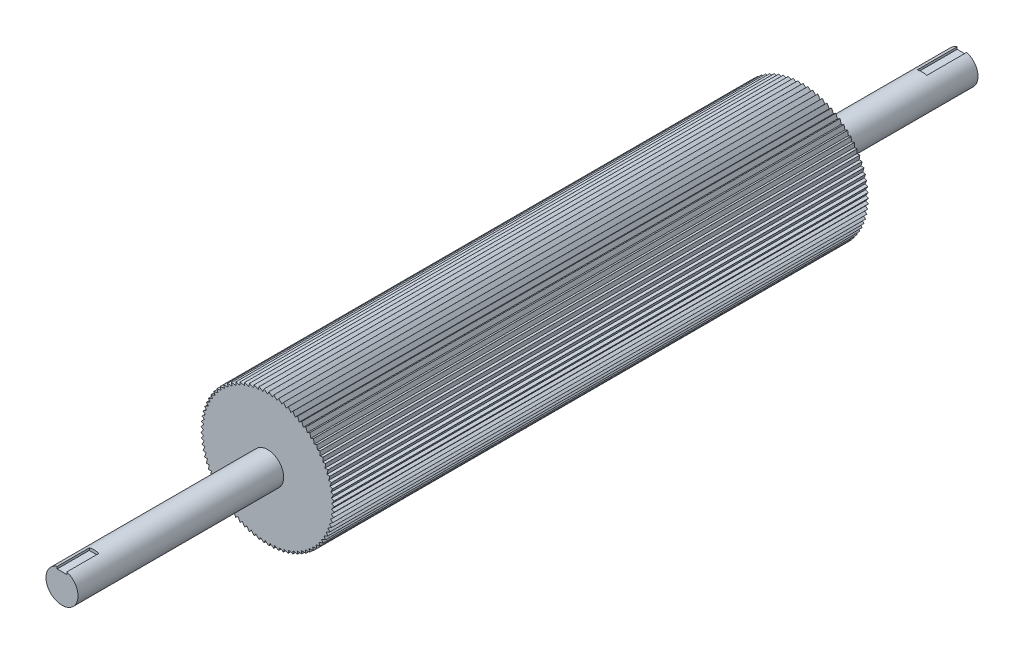
from build123d import *

# Parameters (mm, degrees)
SKETCH2_R           = 125
BOSS_EXTRUDE1_DEPTH = 500
SKETCH3_R           = 30
BOSS_EXTRUDE2_DEPTH = 385
BOSS_EXTRUDE3_START = 300
SKETCH4_R           = 30
BOSS_EXTRUDE3_DEPTH = 300
SKETCH12_W          = 18
SKETCH12_H          = 11
CUT_EXTRUDE5_DEPTH  = 60
CUT_EXTRUDE6_DEPTH  = 1312.96417634
CIRPATTERN1_COUNT   = 85
SKETCH16_W          = 18
SKETCH16_H          = 11
CUT_EXTRUDE7_DEPTH  = 75


with BuildPart() as part:
    # Sketch2 → Boss-Extrude1 (new, symmetric)
    with BuildSketch(Plane.XY):
        Circle(SKETCH2_R)
    extrude(amount=BOSS_EXTRUDE1_DEPTH, both=True)

    # Sketch3 → Boss-Extrude2 (add)
    with BuildSketch(Plane.XY.offset(500)):
        Circle(SKETCH3_R)
    extrude(amount=BOSS_EXTRUDE2_DEPTH)

    # Sketch4 → Boss-Extrude3 (add)
    with BuildSketch(Plane(origin=(0, 0, -500), x_dir=(-1, 0, 0), z_dir=(0, 0, -1)).offset(BOSS_EXTRUDE3_START)):
        Circle(SKETCH4_R)
    extrude(amount=-BOSS_EXTRUDE3_DEPTH)

    # Sketch12 → Cut-Extrude5 (cut)
    with BuildSketch(Plane.XY.offset(885)):
        with Locations((0, 30)):
            Rectangle(SKETCH12_W, SKETCH12_H)
    extrude(amount=-CUT_EXTRUDE5_DEPTH, mode=Mode.SUBTRACT)

    # Sketch15 → Cut-Extrude6 (cut, through all)
    with BuildSketch(Plane.XY.offset(500)):
        with BuildLine():
            Line((0, 120), (2.321485149, 124.978440968))
            ThreePointArc((2.321485149, 124.978440968), (-2.276223403, 124.97927351), (-6.870852473, 124.811022695))
            Line((-6.870852473, 124.811022695), (0, 120))
        make_face()
    cut_extrude6 = extrude(amount=-CUT_EXTRUDE6_DEPTH, mode=Mode.SUBTRACT)

    # CirPattern1: Cut-Extrude6 ×85 about axis
    cirpattern1_axis = Axis((0, 0, 500), (0, 0, -1))
    for i in range(1, CIRPATTERN1_COUNT):
        add(cut_extrude6.rotate(cirpattern1_axis, i * 360 / CIRPATTERN1_COUNT), mode=Mode.SUBTRACT)

    # Sketch16 → Cut-Extrude7 (cut)
    with BuildSketch(Plane(origin=(0, 0, -800), x_dir=(-1, 0, 0), z_dir=(0, 0, -1))):
        with Locations((0, 30)):
            Rectangle(SKETCH16_W, SKETCH16_H)
    extrude(amount=-CUT_EXTRUDE7_DEPTH, mode=Mode.SUBTRACT)


solid = part.part
